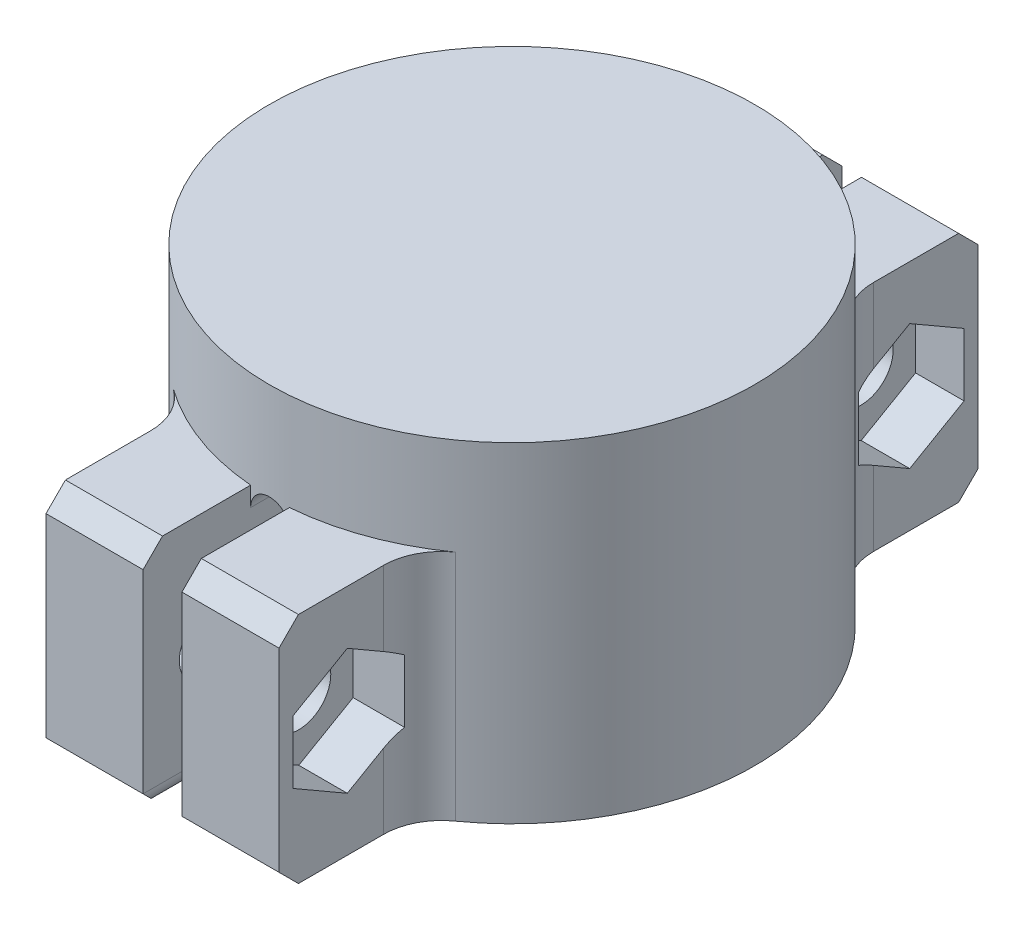
from build123d import *

# Parameters (mm, degrees)
BOSS_EXTRUDE1_DEPTH   = 12
BOSS_EXTRUDE1_2_DEPTH = 12
SKETCH2_R             = 12.5
BOSS_EXTRUDE2_DEPTH   = 5
CUT_EXTRUDE1_REACH    = 32.907
SKETCH4_R             = 1.65
CUT_EXTRUDE2_DEPTH    = 2.5
CHAMFER1_SIZE         = 1
FILLET1_R             = 3
FILLET2_R             = 1
FILLET3_R             = 1


with BuildPart() as part:
    # Sketch1 → Boss-Extrude1 (new body)
    with BuildSketch(Plane(origin=(0, 0, 0), x_dir=(1, 0, 0), z_dir=(0, 1, 0))):
        with BuildLine():
            Line((-6, 10.9658561), (-6, 18))
            Line((-6, 18), (-1, 18))
            Line((-1, 18), (-1, 7.433034374))
            ThreePointArc((-1, 7.433034374), (-7.5, 0), (-1, -7.433034374))
            Line((-1, -7.433034374), (-1, -18))
            Line((-1, -18), (-6, -18))
            Line((-6, -18), (-6, -10.9658561))
            ThreePointArc((-6, -10.9658561), (-12.5, 0), (-6, 10.9658561))
        make_face()
    extrude(amount=BOSS_EXTRUDE1_DEPTH)



with BuildPart() as body_2:
    # Sketch1 → Boss-Extrude1 2 (new body)
    with BuildSketch(Plane(origin=(0, 0, 0), x_dir=(1, 0, 0), z_dir=(0, 1, 0))):
        with BuildLine():
            Line((6, -18), (6, -10.9658561))
            ThreePointArc((6, -10.9658561), (12.5, 0), (6, 10.9658561))
            Line((6, 10.9658561), (6, 18))
            Line((6, 18), (1, 18))
            Line((1, 18), (1, 7.433034374))
            ThreePointArc((1, 7.433034374), (7.5, 0), (1, -7.433034374))
            Line((1, -7.433034374), (1, -18))
            Line((1, -18), (6, -18))
        make_face()
    extrude(amount=BOSS_EXTRUDE1_2_DEPTH)


with BuildPart() as part_1:
    add(part.part)

    add(body_2.part)  # Boss-Extrude2 merges body 2
    # Sketch2 → Boss-Extrude2 (add)
    with BuildSketch(Plane(origin=(0, 12, 0), x_dir=(1, 0, 0), z_dir=(0, 1, 0))):
        with Locations(Location((0, 0, 0), (0, 0, 85.411434264))):
            Circle(SKETCH2_R)
    extrude(amount=BOSS_EXTRUDE2_DEPTH)

    # Cut-Extrude1: up to this face of the body (flat: up to its plane)
    cut_extrude1_end = Plane(part_1.part.faces().sort_by_distance((6, 6, 14.48292805))[0])
    # Sketch4 → Cut-Extrude1 (cut, up to the picked face)
    with BuildSketch(Plane.ZY.offset(6), mode=Mode.PRIVATE) as cut_extrude1_sk1:
        with Locations((-14.48292805, 6)):
            Circle(SKETCH4_R)
    cut_extrude1_tool1 = split(extrude(cut_extrude1_sk1.sketch, amount=-CUT_EXTRUDE1_REACH, mode=Mode.PRIVATE), bisect_by=cut_extrude1_end, keep=Keep.BOTH, mode=Mode.PRIVATE)
    # Sketch4 → Cut-Extrude1 (cut, up to the picked face)
    with BuildSketch(Plane.ZY.offset(6), mode=Mode.PRIVATE) as cut_extrude1_sk2:
        with Locations((14.48292805, 6)):
            Circle(SKETCH4_R)
    cut_extrude1_tool2 = split(extrude(cut_extrude1_sk2.sketch, amount=-CUT_EXTRUDE1_REACH, mode=Mode.PRIVATE), bisect_by=cut_extrude1_end, keep=Keep.BOTH, mode=Mode.PRIVATE)
    add(cut_extrude1_tool1.solids().sort_by(Axis((-6, 6, -14.482928), (1, 0, 0)))[0], mode=Mode.SUBTRACT)
    add(cut_extrude1_tool2.solids().sort_by(Axis((-6, 6, 14.482928), (1, 0, 0)))[0], mode=Mode.SUBTRACT)

    # Sketch5 → Cut-Extrude2 (cut)
    with BuildSketch(Plane(origin=(6, 0, 0), x_dir=(0, 0, -1), z_dir=(1, 0, 0))):
        Polygon((-14.48292805, 9.233161507), (-17.28292805, 7.616580754), (-17.28292805, 4.383419246), (-14.48292805, 2.766838493), (-11.68292805, 4.383419246), (-11.68292805, 7.616580754), align=None)
        Polygon((14.48292805, 9.233161507), (11.68292805, 7.616580754), (11.68292805, 4.383419246), (14.48292805, 2.766838493), (17.28292805, 4.383419246), (17.28292805, 7.616580754), align=None)
    extrude(amount=-CUT_EXTRUDE2_DEPTH, mode=Mode.SUBTRACT)

    # Chamfer1
    chamfer1_edges = [part_1.edges().sort_by_distance(p)[0] for p in [
        (3.5, 0, 18),
        (3.5, 12, 18),
        (3.5, 12, -18),
        (-3.5, 12, -18),
        (-3.5, 0, 18),
        (-3.5, 0, -18),
        (-3.5, 12, 18),
        (3.5, 0, -18),
    ]]
    chamfer(chamfer1_edges, length=CHAMFER1_SIZE)

    # Fillet1
    # the kernel refuses this fillet: 3 mm, written as the material it adds along each edge
    with BuildSketch(Plane(origin=(-6, 0, 10.9658561), x_dir=(-0.8472084674167688, 0, -0.5312605883531453), z_dir=(0, 1, 0))) as fillet1_piece_1:
        with BuildLine():
            CenterArc((1.663147044, 2.994703121), FILLET1_R, 212.090667332, 54.50406735)
            Line((-0.878478358, 1.400921356), (0, 0))
            ThreePointArc((0, 0), (0.742476359, 0.02207033), (1.484952718, 0))
        make_face()
    extrude(amount=12)
    with BuildSketch(Plane(origin=(-6, 0, -10.9658561), x_dir=(0, 0, -1), z_dir=(0, 1, 0))) as fillet1_piece_2:
        with BuildLine():
            CenterArc((1.653573364, 3), FILLET1_R, 215.49593265, 54.50406735)
            ThreePointArc((-0.788896854, 1.258064516), (-0.375750257, 0.640757354), (0, 0))
            Line((0, 0), (1.653573364, 0))
        make_face()
    extrude(amount=12)
    with BuildSketch(Plane(origin=(6, 0, 10.9658561), x_dir=(0.8472084674167693, 0, -0.5312605883531445), z_dir=(0, 1, 0))) as fillet1_piece_3_section:
        with BuildLine():
            CenterArc((1.663147044, -2.994703121), FILLET1_R, 93.405265318, 54.50406735)
            Line((-0.878478358, -1.400921356), (0, 0))
            ThreePointArc((0, 0), (0.742476359, -0.02207033), (1.484952718, 0))
        make_face()
    fillet1_piece_3 = extrude(amount=12, mode=Mode.PRIVATE)
    fillet1_piece_3 = split(fillet1_piece_3, bisect_by=Plane(origin=(6.337461172, 2.39460816, 11.68292805), z_dir=(0, 0, -1)), keep=Keep.TOP, mode=Mode.PRIVATE)
    fillet1_piece_3 = split(fillet1_piece_3, bisect_by=Plane(origin=(6.337461172, 4.190564283, 12.016962645), z_dir=(0, -0.8660254037844386, -0.5000000000000002)), keep=Keep.TOP, mode=Mode.PRIVATE)
    add(fillet1_piece_3)
    with BuildSketch(Plane(origin=(6, 0, 10.9658561), x_dir=(0.8472084674167693, 0, -0.5312605883531445), z_dir=(0, 1, 0))) as fillet1_piece_4_section:
        with BuildLine():
            CenterArc((1.663147044, -2.994703121), FILLET1_R, 93.405265318, 54.50406735)
            Line((-0.878478358, -1.400921356), (0, 0))
            ThreePointArc((0, 0), (0.742476359, -0.02207033), (1.484952718, 0))
        make_face()
    fillet1_piece_4 = extrude(amount=12, mode=Mode.PRIVATE)
    fillet1_piece_4 = split(fillet1_piece_4, bisect_by=Plane(origin=(6.004610603, 2.08996972, 11.68292805), z_dir=(0, 0, 1)), keep=Keep.TOP, mode=Mode.PRIVATE)
    fillet1_piece_4 = split(fillet1_piece_4, bisect_by=Plane(origin=(6.004610603, 3.657447011, 12.940348845), z_dir=(0, -0.8660254037844386, -0.5000000000000002)), keep=Keep.TOP, mode=Mode.PRIVATE)
    add(fillet1_piece_4)
    with BuildSketch(Plane(origin=(6, 0, 10.9658561), x_dir=(0.8472084674167693, 0, -0.5312605883531445), z_dir=(0, 1, 0))) as fillet1_piece_5_section:
        with BuildLine():
            CenterArc((1.663147044, -2.994703121), FILLET1_R, 93.405265318, 54.50406735)
            Line((-0.878478358, -1.400921356), (0, 0))
            ThreePointArc((0, 0), (0.742476359, -0.02207033), (1.484952718, 0))
        make_face()
    fillet1_piece_5 = extrude(amount=12, mode=Mode.PRIVATE)
    fillet1_piece_5 = split(fillet1_piece_5, bisect_by=Plane(origin=(6.283099083, 6.940912679, 10.512636616), z_dir=(0, -0.8660254037844385, 0.5000000000000004)), keep=Keep.TOP, mode=Mode.PRIVATE)
    fillet1_piece_5 = split(fillet1_piece_5, bisect_by=Plane(origin=(6.283099083, 6, 11.68292805), z_dir=(0, 0, -1)), keep=Keep.TOP, mode=Mode.PRIVATE)
    fillet1_piece_5 = split(fillet1_piece_5, bisect_by=Plane(origin=(6.283099083, 5.059087321, 10.512636616), z_dir=(0, 0.8660254037844386, 0.5000000000000002)), keep=Keep.TOP, mode=Mode.PRIVATE)
    add(fillet1_piece_5)
    with BuildSketch(Plane(origin=(6, 0, 10.9658561), x_dir=(0.8472084674167693, 0, -0.5312605883531445), z_dir=(0, 1, 0))) as fillet1_piece_6_section:
        with BuildLine():
            CenterArc((1.663147044, -2.994703121), FILLET1_R, 93.405265318, 54.50406735)
            Line((-0.878478358, -1.400921356), (0, 0))
            ThreePointArc((0, 0), (0.742476359, -0.02207033), (1.484952718, 0))
        make_face()
    fillet1_piece_6 = extrude(amount=12, mode=Mode.PRIVATE)
    fillet1_piece_6 = split(fillet1_piece_6, bisect_by=Plane(origin=(6.337461172, 7.809435717, 12.016962645), z_dir=(0, 0.8660254037844385, -0.5000000000000004)), keep=Keep.TOP, mode=Mode.PRIVATE)
    fillet1_piece_6 = split(fillet1_piece_6, bisect_by=Plane(origin=(6.337461172, 9.60539184, 11.68292805), z_dir=(0, 0, -1)), keep=Keep.TOP, mode=Mode.PRIVATE)
    add(fillet1_piece_6)
    with BuildSketch(Plane(origin=(6, 0, 10.9658561), x_dir=(0.8472084674167693, 0, -0.5312605883531445), z_dir=(0, 1, 0))) as fillet1_piece_7_section:
        with BuildLine():
            CenterArc((1.663147044, -2.994703121), FILLET1_R, 93.405265318, 54.50406735)
            Line((-0.878478358, -1.400921356), (0, 0))
            ThreePointArc((0, 0), (0.742476359, -0.02207033), (1.484952718, 0))
        make_face()
    fillet1_piece_7 = extrude(amount=12, mode=Mode.PRIVATE)
    fillet1_piece_7 = split(fillet1_piece_7, bisect_by=Plane(origin=(6.004610603, 8.342552989, 12.940348845), z_dir=(0, 0.8660254037844385, -0.5000000000000004)), keep=Keep.TOP, mode=Mode.PRIVATE)
    fillet1_piece_7 = split(fillet1_piece_7, bisect_by=Plane(origin=(6.004610603, 9.91003028, 11.68292805), z_dir=(0, 0, 1)), keep=Keep.TOP, mode=Mode.PRIVATE)
    add(fillet1_piece_7)
    with BuildSketch(Plane(origin=(6, 0, -10.9658561), x_dir=(0.8472084674167686, 0, 0.5312605883531455), z_dir=(0, 1, 0))) as fillet1_piece_8_section:
        with BuildLine():
            CenterArc((1.663147044, 2.994703121), FILLET1_R, 212.090667332, 54.50406735)
            Line((-0.878478358, 1.400921356), (0, 0))
            ThreePointArc((0, 0), (0.742476359, 0.02207033), (1.484952718, 0))
        make_face()
    fillet1_piece_8 = extrude(amount=12, mode=Mode.PRIVATE)
    fillet1_piece_8 = split(fillet1_piece_8, bisect_by=Plane(origin=(6.337461172, 4.190564283, -12.016962645), z_dir=(0, -0.8660254037844386, 0.5000000000000002)), keep=Keep.TOP, mode=Mode.PRIVATE)
    fillet1_piece_8 = split(fillet1_piece_8, bisect_by=Plane(origin=(6.337461172, 2.39460816, -11.68292805), z_dir=(0, 0, 1)), keep=Keep.TOP, mode=Mode.PRIVATE)
    add(fillet1_piece_8)
    with BuildSketch(Plane(origin=(6, 0, -10.9658561), x_dir=(0.8472084674167686, 0, 0.5312605883531455), z_dir=(0, 1, 0))) as fillet1_piece_9_section:
        with BuildLine():
            CenterArc((1.663147044, 2.994703121), FILLET1_R, 212.090667332, 54.50406735)
            Line((-0.878478358, 1.400921356), (0, 0))
            ThreePointArc((0, 0), (0.742476359, 0.02207033), (1.484952718, 0))
        make_face()
    fillet1_piece_9 = extrude(amount=12, mode=Mode.PRIVATE)
    fillet1_piece_9 = split(fillet1_piece_9, bisect_by=Plane(origin=(6.004610603, 3.657447011, -12.940348845), z_dir=(0, -0.8660254037844386, 0.5000000000000002)), keep=Keep.TOP, mode=Mode.PRIVATE)
    fillet1_piece_9 = split(fillet1_piece_9, bisect_by=Plane(origin=(6.004610603, 2.08996972, -11.68292805), z_dir=(0, 0, -1)), keep=Keep.TOP, mode=Mode.PRIVATE)
    add(fillet1_piece_9)
    with BuildSketch(Plane(origin=(6, 0, -10.9658561), x_dir=(0.8472084674167686, 0, 0.5312605883531455), z_dir=(0, 1, 0))) as fillet1_piece_10_section:
        with BuildLine():
            CenterArc((1.663147044, 2.994703121), FILLET1_R, 212.090667332, 54.50406735)
            Line((-0.878478358, 1.400921356), (0, 0))
            ThreePointArc((0, 0), (0.742476359, 0.02207033), (1.484952718, 0))
        make_face()
    fillet1_piece_10 = extrude(amount=12, mode=Mode.PRIVATE)
    fillet1_piece_10 = split(fillet1_piece_10, bisect_by=Plane(origin=(6.283099083, 5.059087321, -10.512636616), z_dir=(0, 0.8660254037844386, -0.5000000000000002)), keep=Keep.TOP, mode=Mode.PRIVATE)
    fillet1_piece_10 = split(fillet1_piece_10, bisect_by=Plane(origin=(6.283099083, 6, -11.68292805), z_dir=(0, 0, 1)), keep=Keep.TOP, mode=Mode.PRIVATE)
    fillet1_piece_10 = split(fillet1_piece_10, bisect_by=Plane(origin=(6.283099083, 6.940912679, -10.512636616), z_dir=(0, -0.8660254037844386, -0.5000000000000002)), keep=Keep.TOP, mode=Mode.PRIVATE)
    add(fillet1_piece_10)
    with BuildSketch(Plane(origin=(6, 0, -10.9658561), x_dir=(0.8472084674167686, 0, 0.5312605883531455), z_dir=(0, 1, 0))) as fillet1_piece_11_section:
        with BuildLine():
            CenterArc((1.663147044, 2.994703121), FILLET1_R, 212.090667332, 54.50406735)
            Line((-0.878478358, 1.400921356), (0, 0))
            ThreePointArc((0, 0), (0.742476359, 0.02207033), (1.484952718, 0))
        make_face()
    fillet1_piece_11 = extrude(amount=12, mode=Mode.PRIVATE)
    fillet1_piece_11 = split(fillet1_piece_11, bisect_by=Plane(origin=(6.337461172, 9.60539184, -11.68292805), z_dir=(0, 0, 1)), keep=Keep.TOP, mode=Mode.PRIVATE)
    fillet1_piece_11 = split(fillet1_piece_11, bisect_by=Plane(origin=(6.337461172, 7.809435717, -12.016962645), z_dir=(0, 0.8660254037844386, 0.5000000000000002)), keep=Keep.TOP, mode=Mode.PRIVATE)
    add(fillet1_piece_11)
    with BuildSketch(Plane(origin=(6, 0, -10.9658561), x_dir=(0.8472084674167686, 0, 0.5312605883531455), z_dir=(0, 1, 0))) as fillet1_piece_12_section:
        with BuildLine():
            CenterArc((1.663147044, 2.994703121), FILLET1_R, 212.090667332, 54.50406735)
            Line((-0.878478358, 1.400921356), (0, 0))
            ThreePointArc((0, 0), (0.742476359, 0.02207033), (1.484952718, 0))
        make_face()
    fillet1_piece_12 = extrude(amount=12, mode=Mode.PRIVATE)
    fillet1_piece_12 = split(fillet1_piece_12, bisect_by=Plane(origin=(6.004610603, 9.91003028, -11.68292805), z_dir=(0, 0, -1)), keep=Keep.TOP, mode=Mode.PRIVATE)
    fillet1_piece_12 = split(fillet1_piece_12, bisect_by=Plane(origin=(6.004610603, 8.342552989, -12.940348845), z_dir=(0, 0.8660254037844386, 0.5000000000000002)), keep=Keep.TOP, mode=Mode.PRIVATE)
    add(fillet1_piece_12)

    # Fillet2
    fillet2_edges = [part_1.edges().sort_by_distance(p)[0] for p in [
        (1, 6, -7.433034374),
        (1, 6, 7.433034374),
        (-1, 6, 7.433034374),
        (-1, 6, -7.433034374),
    ]]
    fillet(fillet2_edges, radius=FILLET2_R)

    # Fillet3
    # the kernel refuses this fillet: 1 mm, written as the material it adds along each edge
    with BuildSketch(Plane(origin=(1, 12, -14.959935794), x_dir=(0, -1, 0), z_dir=(0, 0, 1))) as fillet3_piece_1_section:
        with BuildLine():
            CenterArc((FILLET3_R, -FILLET3_R), FILLET3_R, 90, 90)
            Line((0, -FILLET3_R), (0, 0))
            Line((0, 0), (FILLET3_R, 0))
        make_face()
    fillet3_piece_1 = extrude(amount=6.698579973, mode=Mode.PRIVATE)
    fillet3_piece_1 = fillet3_piece_1 & Plane(origin=(0, 11.776915092, 0), x_dir=(0.08000000000372605, 0, -0.99679486354987), z_dir=(0, -1, 0)) * Cylinder(12.5, 18, mode=Mode.PRIVATE)
    add(fillet3_piece_1)
    with BuildSketch(Plane(origin=(2, 12, -8.261355821), x_dir=(-1, 0, 0), z_dir=(0, 0, -1))) as fillet3_piece_2:
        with BuildLine():
            CenterArc((1 + FILLET3_R, -FILLET3_R), FILLET3_R, 90, 90)
            Line((1 + FILLET3_R, 0), (1, 0))
            Line((1, 0), (1, -FILLET3_R))
        make_face()
    revolve(axis=Axis((2, 12, -8.261355821), (0, 1, 0)), revolution_arc=76.391039369)
    with BuildSketch(Plane(origin=(1, 12, 8.261355821), x_dir=(-1, 0, 0), z_dir=(0, 0, 1))) as fillet3_piece_3_section:
        with BuildLine():
            CenterArc((FILLET3_R, FILLET3_R), FILLET3_R, 180, 90)
            Line((0, FILLET3_R), (0, 0))
            Line((0, 0), (FILLET3_R, 0))
        make_face()
    fillet3_piece_3 = extrude(amount=6.698579973, mode=Mode.PRIVATE)
    fillet3_piece_3 = fillet3_piece_3 & Plane(origin=(0, 11.77691513, 0), x_dir=(0.08000000000372605, 0, -0.99679486354987), z_dir=(0, -1, 0)) * Cylinder(12.5, 18, mode=Mode.PRIVATE)
    add(fillet3_piece_3)
    with BuildSketch(Plane(origin=(2, 12, 8.261355821), x_dir=(-1, 0, 0), z_dir=(0, 0, 1))) as fillet3_piece_4:
        with BuildLine():
            CenterArc((1 + FILLET3_R, FILLET3_R), FILLET3_R, 180, 90)
            Line((1, FILLET3_R), (1, 0))
            Line((1, 0), (1 + FILLET3_R, 0))
        make_face()
    revolve(axis=Axis((2, 12, 8.261355821), (0, -1, 0)), revolution_arc=76.391039369)
    with BuildSketch(Plane(origin=(-1, 12, 8.261355821), x_dir=(1, 0, 0), z_dir=(0, 0, 1))) as fillet3_piece_5_section:
        with BuildLine():
            CenterArc((FILLET3_R, -FILLET3_R), FILLET3_R, 90, 90)
            Line((0, -FILLET3_R), (0, 0))
            Line((0, 0), (FILLET3_R, 0))
        make_face()
    fillet3_piece_5 = extrude(amount=6.698579973, mode=Mode.PRIVATE)
    fillet3_piece_5 = fillet3_piece_5 & Plane(origin=(0, 11.77691513, 0), x_dir=(0.08000000000372605, 0, -0.99679486354987), z_dir=(0, -1, 0)) * Cylinder(12.5, 18, mode=Mode.PRIVATE)
    add(fillet3_piece_5)
    with BuildSketch(Plane(origin=(-2, 12, 8.261355821), x_dir=(1, 0, 0), z_dir=(0, 0, 1))) as fillet3_piece_6:
        with BuildLine():
            CenterArc((1 + FILLET3_R, -FILLET3_R), FILLET3_R, 90, 90)
            Line((1, -FILLET3_R), (1, 0))
            Line((1, 0), (1 + FILLET3_R, 0))
        make_face()
    revolve(axis=Axis((-2, 12, 8.261355821), (0, 1, 0)), revolution_arc=76.391039369)
    with BuildSketch(Plane(origin=(-1, 12, -14.959935794), x_dir=(1, 0, 0), z_dir=(0, 0, 1))) as fillet3_piece_7_section:
        with BuildLine():
            CenterArc((FILLET3_R, -FILLET3_R), FILLET3_R, 90, 90)
            Line((0, -FILLET3_R), (0, 0))
            Line((0, 0), (FILLET3_R, 0))
        make_face()
    fillet3_piece_7 = extrude(amount=6.698579973, mode=Mode.PRIVATE)
    fillet3_piece_7 = fillet3_piece_7 & Plane(origin=(0, 11.77691513, 0), x_dir=(0.08000000000372605, 0, -0.99679486354987), z_dir=(0, -1, 0)) * Cylinder(12.5, 18, mode=Mode.PRIVATE)
    add(fillet3_piece_7)
    with BuildSketch(Plane(origin=(-2, 12, -8.261355821), x_dir=(1, 0, 0), z_dir=(0, 0, -1))) as fillet3_piece_8:
        with BuildLine():
            CenterArc((1 + FILLET3_R, FILLET3_R), FILLET3_R, 180, 90)
            Line((1, FILLET3_R), (1, 0))
            Line((1, 0), (1 + FILLET3_R, 0))
        make_face()
    revolve(axis=Axis((-2, 12, -8.261355821), (0, -1, 0)), revolution_arc=76.391039369)
    with BuildSketch(Plane(origin=(0, 12, 0), x_dir=(0.23529411764705882, 0, -0.9719242142269592), z_dir=(-0.9719242142269592, 0, -0.23529411764705882))) as fillet3_piece_9:
        with BuildLine():
            CenterArc((7.5 - FILLET3_R, FILLET3_R), FILLET3_R, 270, 90)
            Line((7.5, FILLET3_R), (7.5, 0))
            Line((7.5, 0), (7.5 - FILLET3_R, 0))
        make_face()
    revolve(axis=Axis((0, 12, 0), (0, -1, 0)), revolution_arc=152.782078738)
    with BuildSketch(Plane(origin=(0, 12, 0), x_dir=(-0.235294117647059, 0, -0.9719242142269591), z_dir=(0.9719242142269591, 0, -0.235294117647059))) as fillet3_piece_10:
        with BuildLine():
            CenterArc((7.5 - FILLET3_R, -FILLET3_R), FILLET3_R, 0, 90)
            Line((7.5, -FILLET3_R), (7.5, 0))
            Line((7.5, 0), (7.5 - FILLET3_R, 0))
        make_face()
    revolve(axis=Axis((0, 12, 0), (0, 1, 0)), revolution_arc=152.782078738)
    # the kernel refuses this fillet: 1 mm, written as the material it takes off along each edge
    with BuildSketch(Plane(origin=(1, 0, -19.5), x_dir=(0, 1, 0), z_dir=(0, 0, 1)), Plane(origin=(-1, 0, 8.261355821), x_dir=(-1, 0, 0), z_dir=(0, 0, 1))) as fillet3_2_piece_1:
        with BuildLine():
            CenterArc((FILLET3_R, -FILLET3_R), FILLET3_R, 90, 90)
            Line((0, -FILLET3_R), (0, 0))
            Line((0, 0), (FILLET3_R, 0))
        make_face()
    extrude(amount=11.238644179, mode=Mode.SUBTRACT)
    with BuildSketch(Plane(origin=(2, 0, -8.261355821), x_dir=(-1, 0, 0), z_dir=(0, 0, -1))) as fillet3_2_piece_2:
        with BuildLine():
            CenterArc((1 - FILLET3_R, FILLET3_R), FILLET3_R, 270, 90)
            Line((1 - FILLET3_R, 0), (1, 0))
            Line((1, 0), (1, FILLET3_R))
        make_face()
    revolve(axis=Axis((2, 0, -8.261355821), (0, 1, 0)), revolution_arc=76.391039369, mode=Mode.SUBTRACT)
    with BuildSketch(Plane(origin=(1, 0, 8.261355821), x_dir=(1, 0, 0), z_dir=(0, 0, 1)), Plane(origin=(-1, 0, -19.5), x_dir=(0, 1, 0), z_dir=(0, 0, 1))) as fillet3_2_piece_3:
        with BuildLine():
            CenterArc((FILLET3_R, FILLET3_R), FILLET3_R, 180, 90)
            Line((0, FILLET3_R), (0, 0))
            Line((0, 0), (FILLET3_R, 0))
        make_face()
    extrude(amount=11.238644179, mode=Mode.SUBTRACT)
    with BuildSketch(Plane(origin=(2, 0, 8.261355821), x_dir=(-1, 0, 0), z_dir=(0, 0, 1))) as fillet3_2_piece_4:
        with BuildLine():
            CenterArc((1 - FILLET3_R, -FILLET3_R), FILLET3_R, 0, 90)
            Line((1, -FILLET3_R), (1, 0))
            Line((1, 0), (1 - FILLET3_R, 0))
        make_face()
    revolve(axis=Axis((2, 0, 8.261355821), (0, -1, 0)), revolution_arc=76.391039369, mode=Mode.SUBTRACT)
    with BuildSketch(Plane(origin=(-2, 0, 8.261355821), x_dir=(1, 0, 0), z_dir=(0, 0, 1))) as fillet3_2_piece_5:
        with BuildLine():
            CenterArc((1 - FILLET3_R, FILLET3_R), FILLET3_R, 270, 90)
            Line((1, FILLET3_R), (1, 0))
            Line((1, 0), (1 - FILLET3_R, 0))
        make_face()
    revolve(axis=Axis((-2, 0, 8.261355821), (0, 1, 0)), revolution_arc=76.391039369, mode=Mode.SUBTRACT)
    with BuildSketch(Plane(origin=(-2, 0, -8.261355821), x_dir=(1, 0, 0), z_dir=(0, 0, -1))) as fillet3_2_piece_6:
        with BuildLine():
            CenterArc((1 - FILLET3_R, -FILLET3_R), FILLET3_R, 0, 90)
            Line((1 - FILLET3_R, 0), (1, 0))
            Line((1, 0), (1, -FILLET3_R))
        make_face()
    revolve(axis=Axis((-2, 0, -8.261355821), (0, -1, 0)), revolution_arc=76.391039369, mode=Mode.SUBTRACT)
    with BuildSketch(Plane(origin=(0, 0, 0), x_dir=(0.23529411764705874, 0, -0.9719242142269593), z_dir=(-0.9719242142269593, 0, -0.23529411764705874))) as fillet3_2_piece_7:
        with BuildLine():
            CenterArc((7.5 + FILLET3_R, -FILLET3_R), FILLET3_R, 90, 90)
            Line((7.5, -FILLET3_R), (7.5, 0))
            Line((7.5, 0), (7.5 + FILLET3_R, 0))
        make_face()
    revolve(axis=Axis((0, 0, 0), (0, -1, 0)), revolution_arc=152.782078738, mode=Mode.SUBTRACT)
    with BuildSketch(Plane(origin=(0, 0, 0), x_dir=(-0.23529411764705896, 0, -0.9719242142269592), z_dir=(0.9719242142269592, 0, -0.23529411764705896))) as fillet3_2_piece_8:
        with BuildLine():
            CenterArc((7.5 + FILLET3_R, FILLET3_R), FILLET3_R, 180, 90)
            Line((7.5, FILLET3_R), (7.5, 0))
            Line((7.5, 0), (7.5 + FILLET3_R, 0))
        make_face()
    revolve(axis=Axis((0, 0, 0), (0, 1, 0)), revolution_arc=152.782078738, mode=Mode.SUBTRACT)


solid = part_1.part
